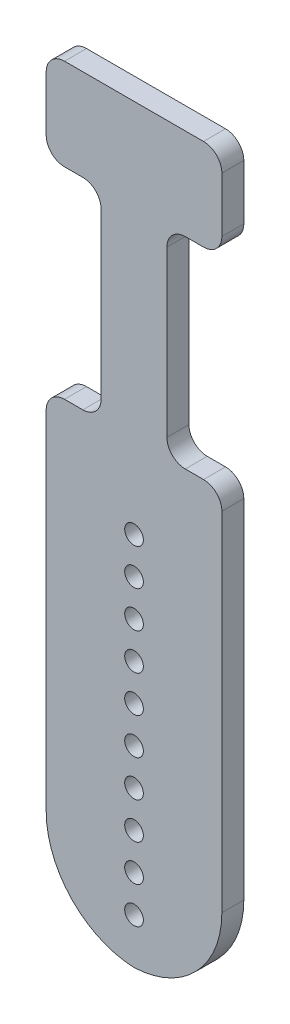
from build123d import *

# Parameters (mm, degrees)
SKETCH1_W               = 48
SKETCH1_H               = 6
BOSS_EXTRUDE1_DEPTH     = 205
FILLET1_R               = 25
SKETCH2_R               = 2.55
CUT_EXTRUDE1_DEPTH      = 207.487287744
LPATTERN1_COUNT         = 10
LPATTERN1_PITCH         = 10
CUT_EXTRUDE2_DEPTH      = 207.421898063
CUT_EXTRUDE2_DEPTH_BACK = 207.421898063
SKETCH12_W              = 15
SKETCH12_H              = 55
FILLET2_R               = 5


with BuildPart() as part:
    # Sketch1 → Boss-Extrude1 (new body)
    with BuildSketch(Plane(origin=(0, 0, 0), x_dir=(1, 0, 0), z_dir=(0, 1, 0))):
        Rectangle(SKETCH1_W, SKETCH1_H)
    extrude(amount=BOSS_EXTRUDE1_DEPTH)

    # Fillet1
    # the kernel refuses this fillet: 25 mm, written as the material it takes off along each edge
    with BuildSketch(Plane(origin=(-24, 0, 65.5), x_dir=(0, 1, 0), z_dir=(0, 0, -1)), Plane(origin=(24, 0, -65.5), x_dir=(0, 1, 0), z_dir=(0, 0, 1))) as fillet1_piece_1:
        with BuildLine():
            CenterArc((FILLET1_R, FILLET1_R), FILLET1_R, 180, 90)
            Line((0, FILLET1_R), (0, 0))
            Line((0, 0), (FILLET1_R, 0))
        make_face()
    extrude(amount=131, mode=Mode.SUBTRACT)

    # Sketch2 → Cut-Extrude1 (cut, through all)
    with BuildSketch(Plane.XY.offset(3)):
        with Locations((0, 12.5)):
            Circle(SKETCH2_R)
    cut_extrude1 = extrude(amount=-CUT_EXTRUDE1_DEPTH, mode=Mode.SUBTRACT)

    # LPattern1: Cut-Extrude1 ×10
    with Locations(*[(0, i * LPATTERN1_PITCH, 0) for i in range(1, LPATTERN1_COUNT)]):
        add(cut_extrude1, mode=Mode.SUBTRACT)

    # Sketch12 → Cut-Extrude2 (cut, two sides: drawn at the far end of the back side and taken through both)
    with BuildSketch(Plane.XY.offset(-CUT_EXTRUDE2_DEPTH_BACK)):
        with Locations((-16.5, 152.5)):
            Rectangle(SKETCH12_W, SKETCH12_H)
        with Locations((16.5, 152.5)):
            Rectangle(SKETCH12_W, SKETCH12_H)
    extrude(amount=CUT_EXTRUDE2_DEPTH + CUT_EXTRUDE2_DEPTH_BACK, mode=Mode.SUBTRACT)

    # Fillet2
    fillet2_edges = [part.edges().sort_by_distance(p)[0] for p in [
        (-24, 205, 0),
        (24, 205, 0),
        (-24, 125, 0),
        (-24, 180, 0),
        (-9, 180, 0),
        (-9, 125, 0),
        (24, 125, 0),
        (9, 125, 0),
        (9, 180, 0),
        (24, 180, 0),
    ]]
    fillet(fillet2_edges, radius=FILLET2_R)


solid = part.part
